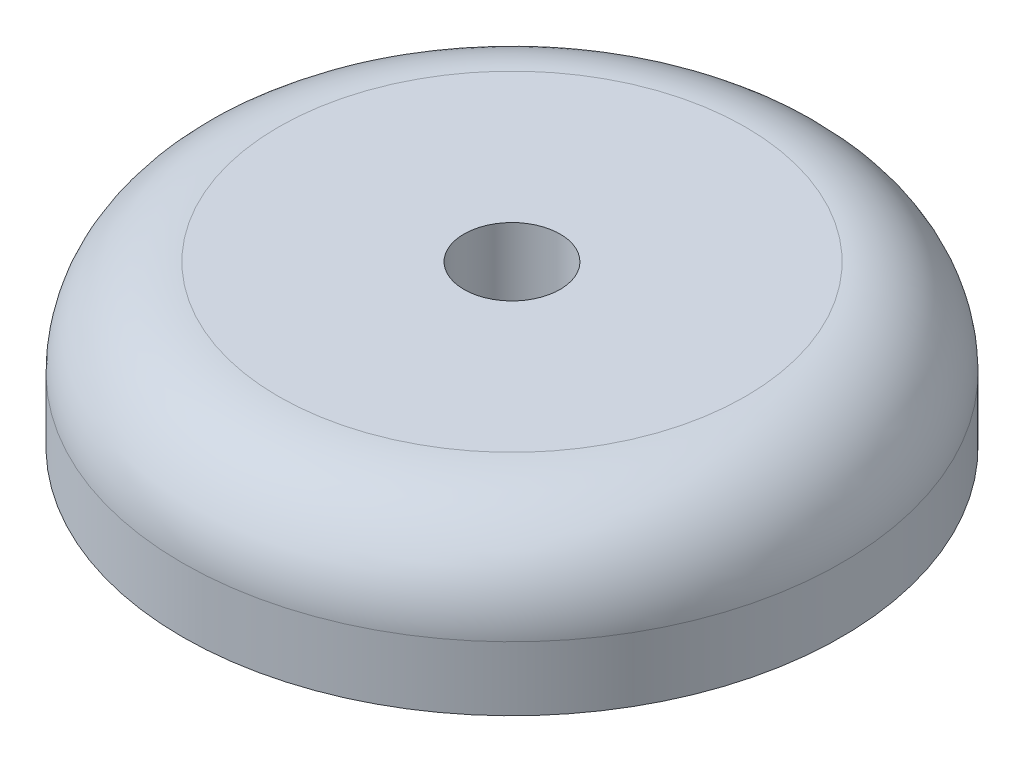
from build123d import *

# Parameters (mm, degrees)
SKETCH1_R           = 10.287
SKETCH1_R_2         = 1.5
BOSS_EXTRUDE1_DEPTH = 5
FILLET1_R           = 3


with BuildPart() as part:
    # Sketch1 → Boss-Extrude1 (new body)
    with BuildSketch(Plane(origin=(0, 0, 0), x_dir=(1, 0, 0), z_dir=(0, 1, 0))):
        Circle(SKETCH1_R)
        Circle(SKETCH1_R_2, mode=Mode.SUBTRACT)
    extrude(amount=BOSS_EXTRUDE1_DEPTH)

    # Fillet1
    fillet1_edges = [part.edges().sort_by_distance(p)[0] for p in [
        (-10.287, 5, 0),
    ]]
    fillet(fillet1_edges, radius=FILLET1_R)


solid = part.part
